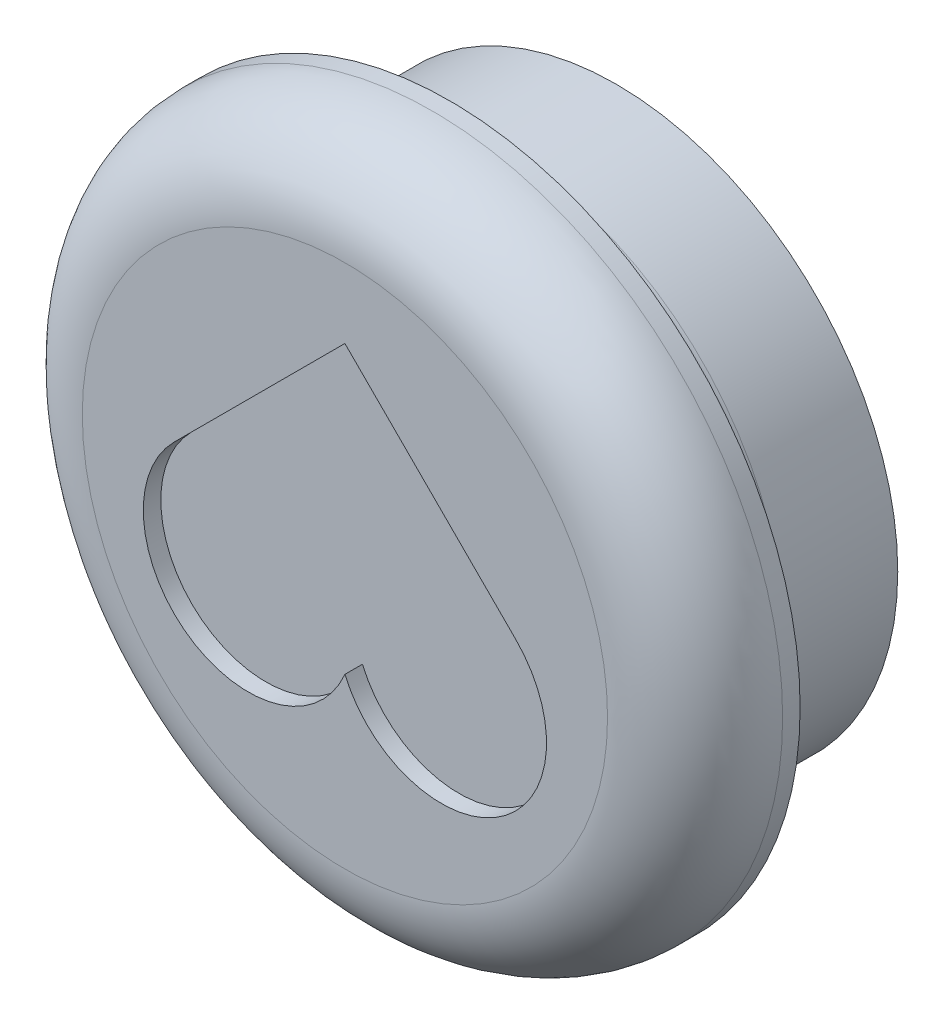
from build123d import *

# Parameters (mm, degrees)
SKETCH_1_R          = 16.075
SKETCH_1_R_2        = 12.575
EXTRUDE_1_DEPTH     = 7.5
SKETCH_2_R          = 16.075
EXTRUDE_2_DEPTH     = 2
SKETCH_3_R          = 20
EXTRUDE_3_DEPTH     = 6
FILLET_1_R          = 5
CUT_EXTRUDE_1_DEPTH = 1
EXTRUDE_4_DEPTH     = 7
CUT_EXTRUDE_2_DEPTH = 4.5
FILLET_2_R          = 3
FILLET_3_R          = 10
FILLET_4_R          = 1


with BuildPart() as part:
    # 草图1 → 凸台-拉伸1 (new body)
    with BuildSketch(Plane.XY):
        Circle(SKETCH_1_R)
        Circle(SKETCH_1_R_2, mode=Mode.SUBTRACT)
    extrude(amount=EXTRUDE_1_DEPTH)

    # 草图2 → 凸台-拉伸2 (add)
    with BuildSketch(Plane.XY.offset(7.5)):
        Circle(SKETCH_2_R)
    extrude(amount=EXTRUDE_2_DEPTH)

    # 草图3 → 凸台-拉伸3 (add)
    with BuildSketch(Plane.XY.offset(9.5)):
        Circle(SKETCH_3_R)
    extrude(amount=EXTRUDE_3_DEPTH)

    # 圆角1
    fillet_1_edges = [part.edges().sort_by_distance(p)[0] for p in [
        (-20, 0, 15.5),
    ]]
    fillet(fillet_1_edges, radius=FILLET_1_R)

    # 草图4 → 切除-拉伸1 (cut)
    with BuildSketch(Plane.XY.offset(15.5)):
        with BuildLine():
            Line((9.757359313, 1.242640687), (0, 11))
            Line((0, 11), (-9.757359313, 1.242640687))
            ThreePointArc((-9.757359313, 1.242640687), (-8.878650761, -7.968295542), (0, -5.363869387))
            ThreePointArc((0, -5.363869387), (8.878650761, -7.968295542), (9.757359313, 1.242640687))
        make_face()
    extrude(amount=-CUT_EXTRUDE_1_DEPTH, mode=Mode.SUBTRACT)

    # 草图6 → 凸台-拉伸4 (add, symmetric)
    with BuildSketch(Plane(origin=(0, 0, 0), x_dir=(1, 0, 0), z_dir=(0, 1, 0))):
        Polygon((10.75, -5), (11.05, 0), (14, 0), (14, -7.5), (10.6, -7.5), align=None)
    extrude_4 = extrude(amount=EXTRUDE_4_DEPTH, both=True)

    # 镜向1: 凸台-拉伸4 across plane
    add(extrude_4.mirror(Plane(origin=(0, 0, 0), x_dir=(0, 0, 1), z_dir=(1, 0, 0))))

    # 草图5 → 切除-拉伸2 (cut)
    with BuildSketch(Plane(origin=(0, 0, 7.5), x_dir=(-1, 0, 0), z_dir=(0, 0, -1))):
        with BuildLine():
            Line((7.767720909, 9.889041252), (0, 2.121320344))
            Line((0, 2.121320344), (-7.767720909, 9.889041252))
            ThreePointArc((-7.767720909, 9.889041252), (0, 12.575), (7.767720909, 9.889041252))
        make_face()
        with BuildLine():
            Line((-7.767720909, -9.889041252), (0, -2.121320344))
            Line((0, -2.121320344), (7.767720909, -9.889041252))
            ThreePointArc((7.767720909, -9.889041252), (0, -12.575), (-7.767720909, -9.889041252))
        make_face()
        with BuildLine():
            Line((-9.889041252, 7.767720909), (-2.121320344, 0))
            Line((-2.121320344, 0), (-9.889041252, -7.767720909))
            ThreePointArc((-9.889041252, -7.767720909), (-10.256771671, -7.275249816), (-10.6, -6.765399101))
            Line((-10.6, -6.765399101), (-10.6, 6.765399101))
            ThreePointArc((-10.6, 6.765399101), (-10.256771671, 7.275249816), (-9.889041252, 7.767720909))
        make_face()
        with BuildLine():
            Line((2.121320344, 0), (9.889041252, 7.767720909))
            ThreePointArc((9.889041252, 7.767720909), (10.256771671, 7.275249816), (10.6, 6.765399101))
            Line((10.6, 6.765399101), (10.6, -6.765399101))
            ThreePointArc((10.6, -6.765399101), (10.256771671, -7.275249816), (9.889041252, -7.767720909))
            Line((9.889041252, -7.767720909), (2.121320344, 0))
        make_face()
    extrude(amount=-CUT_EXTRUDE_2_DEPTH, mode=Mode.SUBTRACT)

    # 圆角2
    fillet_2_edges = [part.edges().sort_by_distance(p)[0] for p in [
        (-16.075, 0, 9.5),
    ]]
    fillet(fillet_2_edges, radius=FILLET_2_R)

    # 圆角3
    # the kernel refuses this fillet: 10 mm, written as the material it takes off along each edge
    with BuildSketch(Plane(origin=(10.6, -7.514725314, 7.5), x_dir=(0.05989229072795002, 0, -0.9982048454657784), z_dir=(0, 1, 0))) as fillet_3_piece_1_section:
        with BuildLine():
            CenterArc((FILLET_3_R * 0.0299730484909, -FILLET_3_R), FILLET_3_R, 90, 3.433630362)
            Line((-FILLET_3_R * 0.029919242237, -FILLET_3_R * 0.00179515453422), (0, 0))
            Line((0, 0), (FILLET_3_R * 0.0299730484909, 0))
        make_face()
    fillet_3_piece_1 = extrude(amount=15.029450627, mode=Mode.PRIVATE)
    fillet_3_piece_1 = fillet_3_piece_1 & Plane(origin=(0, 0, 7.497328359), x_dir=(1, 0, 0), z_dir=(0, 0, -1)) * Cylinder(12.575, 32, mode=Mode.PRIVATE)
    add(fillet_3_piece_1, mode=Mode.SUBTRACT)
    with BuildSketch(Plane(origin=(-10.6, -7.514725314, 7.5), x_dir=(-0.05989229072795002, 0, -0.9982048454657784), z_dir=(0, 1, 0))) as fillet_3_piece_2_section:
        with BuildLine():
            CenterArc((FILLET_3_R * 0.0299730484909, FILLET_3_R), FILLET_3_R, 266.566369638, 3.433630362)
            Line((-FILLET_3_R * 0.029919242237, FILLET_3_R * 0.00179515453422), (0, 0))
            Line((0, 0), (FILLET_3_R * 0.0299730484909, 0))
        make_face()
    fillet_3_piece_2 = extrude(amount=15.029450627, mode=Mode.PRIVATE)
    fillet_3_piece_2 = fillet_3_piece_2 & Plane(origin=(0, 0, 7.497328359), x_dir=(1, 0, 0), z_dir=(0, 0, -1)) * Cylinder(12.575, 32, mode=Mode.PRIVATE)
    add(fillet_3_piece_2, mode=Mode.SUBTRACT)

    # 圆角4
    # the kernel refuses this fillet: 1 mm, written as the material it adds along each edge
    with BuildSketch(Plane(origin=(0, -2.121320344, 7.5), x_dir=(0.7071067811865518, -0.7071067811865432, 0), z_dir=(0, 0, 1)), Plane(origin=(2.121320344, 0, 7.5), x_dir=(0.7071067811865438, 0.7071067811865512, 0), z_dir=(0, 0, 1))) as fillet_4_piece_1:
        with BuildLine():
            CenterArc((FILLET_4_R, -FILLET_4_R), FILLET_4_R, 90, 90)
            Line((0, -FILLET_4_R), (0, 0))
            Line((0, 0), (FILLET_4_R, 0))
        make_face()
    extrude(amount=7)
    with BuildSketch(Plane(origin=(-7.767720909, -9.889041252, 7.5), x_dir=(0.8157540941110909, -0.5783988744292242, 0), z_dir=(0, 0, 1)), Plane(origin=(-9.889041252, 7.767720909, 7.5), x_dir=(-0.5783988744292212, -0.8157540941110929, 0), z_dir=(0, 0, 1)), Plane(origin=(7.767720909, 9.889041252, 7.5), x_dir=(-0.8157540941110928, 0.5783988744292216, 0), z_dir=(0, 0, 1))) as fillet_4_piece_2:
        with BuildLine():
            CenterArc((1.184434693, 0.998796574), FILLET_4_R, 170.338006618, 102.473187785)
            Line((0.198619674, 1.166632059), (0, 0))
            ThreePointArc((0, 0), (0.616739804, -0.015133081), (1.233479607, 0))
        make_face()
    extrude(amount=7.583699018)
    with BuildSketch(Plane(origin=(-9.889041252, -7.767720909, 7.5), x_dir=(-0.578398874429234, 0.8157540941110841, 0), z_dir=(0, 0, 1))) as fillet_4_piece_3_section:
        with BuildLine():
            CenterArc((1.184434693, -0.998796574), FILLET_4_R, 87.188805597, 102.473187785)
            Line((0.198619674, -1.166632059), (0, 0))
            ThreePointArc((0, 0), (0.616739804, 0.015133081), (1.233479607, 0))
        make_face()
    fillet_4_piece_3 = extrude(amount=7.583699018, mode=Mode.PRIVATE)
    fillet_4_piece_3 = split(fillet_4_piece_3, bisect_by=Plane(origin=(-10.600515055, -6.764586018, 14.5), z_dir=(0, 0, -1)), keep=Keep.TOP, mode=Mode.PRIVATE)
    add(fillet_4_piece_3)
    with BuildSketch(Plane(origin=(-2.121320344, 0, 7.5), x_dir=(-0.7071067811865511, 0.7071067811865441, 0), z_dir=(0, 0, 1)), Plane(origin=(0, 2.121320344, 7.5), x_dir=(0.7071067811865439, 0.7071067811865512, 0), z_dir=(0, 0, 1))) as fillet_4_piece_4:
        with BuildLine():
            CenterArc((FILLET_4_R, FILLET_4_R), FILLET_4_R, 180, 90)
            Line((0, FILLET_4_R), (0, 0))
            Line((0, 0), (FILLET_4_R, 0))
        make_face()
    extrude(amount=7)
    with BuildSketch(Plane(origin=(-7.767720909, 9.889041252, 7.5), x_dir=(0.8157540941110883, 0.5783988744292278, 0), z_dir=(0, 0, 1)), Plane(origin=(9.889041252, 7.767720909, 7.5), x_dir=(0.5783988744292311, -0.8157540941110861, 0), z_dir=(0, 0, 1)), Plane(origin=(7.767720909, -9.889041252, 7.5), x_dir=(-0.8157540941110859, -0.5783988744292314, 0), z_dir=(0, 0, 1))) as fillet_4_piece_5:
        with BuildLine():
            CenterArc((1.184434693, -0.998796574), FILLET_4_R, 87.188805597, 102.473187785)
            Line((0.198619674, -1.166632059), (0, 0))
            ThreePointArc((0, 0), (0.616739804, 0.015133081), (1.233479607, 0))
        make_face()
    extrude(amount=7.583699018)
    with BuildSketch(Plane(origin=(9.889041252, -7.767720909, 7.5), x_dir=(0.5783988744292226, 0.8157540941110919, 0), z_dir=(0, 0, 1))) as fillet_4_piece_6_section:
        with BuildLine():
            CenterArc((1.184434693, 0.998796574), FILLET_4_R, 170.338006618, 102.473187785)
            Line((0.198619674, 1.166632059), (0, 0))
            ThreePointArc((0, 0), (0.616739804, -0.015133081), (1.233479607, 0))
        make_face()
    fillet_4_piece_6 = extrude(amount=7.583699018, mode=Mode.PRIVATE)
    fillet_4_piece_6 = split(fillet_4_piece_6, bisect_by=Plane(origin=(10.600515055, -6.764586018, 14.5), z_dir=(0, 0, -1)), keep=Keep.TOP, mode=Mode.PRIVATE)
    add(fillet_4_piece_6)


solid = part.part
